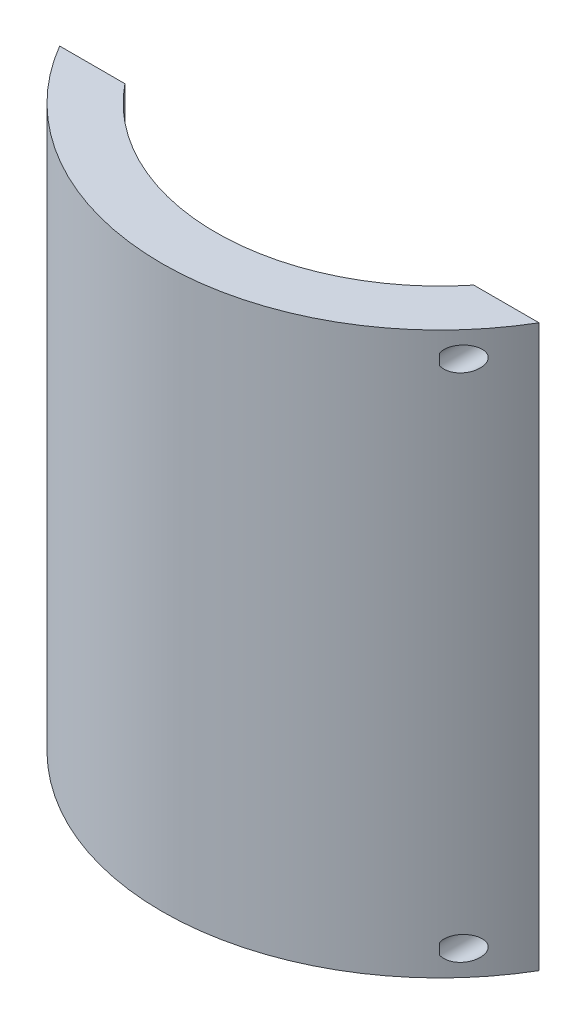
from build123d import *

# Parameters (mm, degrees)
BOSS_EXTRUDE1_DEPTH                        = 100
SKETCH2_R                                  = 2.15
CUT_EXTRUDE1_DEPTH                         = 10
MIRROR1_AT_THE_SECOND_PLANE_COPY_1_SKETC_R = 2.15
MIRROR1_AT_THE_SECOND_PLANE_COPY_1_DEPTH   = 10


with BuildPart() as part:
    # Sketch1 → Boss-Extrude1 (new body)
    with BuildSketch(Plane(origin=(0, 0, 0), x_dir=(1, 0, 0), z_dir=(0, 1, 0))):
        with BuildLine():
            ThreePointArc((31.086694629, -25.07), (0, -39.936042405), (-31.086694629, -25.07))
            Line((-31.086694629, -25.07), (-42.716694629, -25.07))
            ThreePointArc((-42.716694629, -25.07), (0, -49.53), (42.716694629, -25.07))
            Line((42.716694629, -25.07), (31.086694629, -25.07))
        make_face()
    extrude(amount=BOSS_EXTRUDE1_DEPTH)

    # Sketch2 → Cut-Extrude1 (cut)
    with BuildSketch(Plane(origin=(0, 0, 25.07), x_dir=(-1, 0, 0), z_dir=(0, 0, -1))):
        with Locations((-36.901694629, 4.5125)):
            Circle(SKETCH2_R)
    cut_extrude1 = extrude(amount=-CUT_EXTRUDE1_DEPTH, mode=Mode.SUBTRACT)

    # Mirror1: Cut-Extrude1 across plane
    add(cut_extrude1.mirror(Plane(origin=(0, 50, 0), x_dir=(0, 0, 1), z_dir=(0, -1, 0))), mode=Mode.SUBTRACT)

    # Mirror1 at the second plane: Cut-Extrude1 across plane
    add(cut_extrude1.mirror(Plane(origin=(0, 0, 0), x_dir=(0, 0, 1), z_dir=(1, 0, 0))), mode=Mode.SUBTRACT)

    # Mirror1 at the second plane copy 1 sketc → Mirror1 at the second plane copy 1 (cut)
    with BuildSketch(Plane(origin=(0, 100, 25.07), x_dir=(1, 0, 0), z_dir=(0, 0, -1))):
        with Locations((-36.901694629, 4.5125)):
            Circle(MIRROR1_AT_THE_SECOND_PLANE_COPY_1_SKETC_R)
    extrude(amount=-MIRROR1_AT_THE_SECOND_PLANE_COPY_1_DEPTH, mode=Mode.SUBTRACT)


solid = part.part
